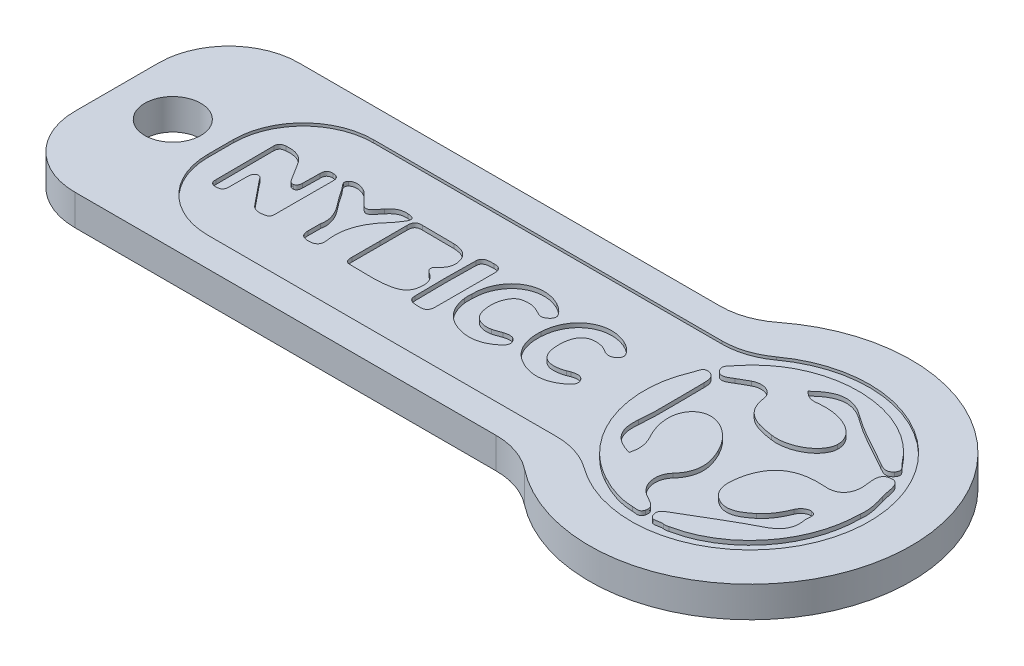
from build123d import *

# Parameters (mm, degrees)
ESQUISSE1_R             = 2
BOSS_EXTRU_1_DEPTH      = 2
ESQUISSE3_R             = 2
BOSS_EXTRU_2_DEPTH      = 0.2
ENL_V_MAT_EXTRU_1_DEPTH = 0.3
BOSS_EXTRU_3_DEPTH      = 0.3
CONG_1_R                = 5


with BuildPart() as part:
    # Esquisse1 → Boss.-Extru.1 (new body)
    with BuildSketch(Plane(origin=(0, 0, 0), x_dir=(1, 0, 0), z_dir=(0, 1, 0))):
        with BuildLine():
            Line((-18.5, 8), (18.5, 8))
            ThreePointArc((18.5, 8), (38.261355821, 0), (18.5, -8))
            Line((18.5, -8), (-18.5, -8))
            Line((-18.5, -8), (-18.5, 8))
        make_face()
        with Locations((-14.5, 0)):
            Circle(ESQUISSE1_R, mode=Mode.SUBTRACT)
    extrude(amount=BOSS_EXTRU_1_DEPTH)

    # Esquisse3 → Boss.-Extru.2 (add)
    with BuildSketch(Plane(origin=(0, 2, 0), x_dir=(1, 0, 0), z_dir=(0, 1, 0))):
        with BuildLine():
            Line((-18.5, -8), (18.5, -8))
            ThreePointArc((18.5, -8), (38.261355821, 0), (18.5, 8))
            Line((18.5, 8), (-18.5, 8))
            Line((-18.5, 8), (-18.5, -8))
        make_face()
        with Locations((-14.5, 0)):
            Circle(ESQUISSE3_R, mode=Mode.SUBTRACT)
        with BuildLine():
            Line((20.655136301, -5.913043478), (-11.087243835, -5.913043478))
            Line((-11.087243835, -5.913043478), (-11.087243835, 5.913043478))
            Line((-11.087243835, 5.913043478), (20.655136301, 5.913043478))
            ThreePointArc((20.655136301, 5.913043478), (35.261355821, 0), (20.655136301, -5.913043478))
        make_face(mode=Mode.SUBTRACT)
    extrude(amount=BOSS_EXTRU_2_DEPTH)

    # Esquisse4 → Enlèv. mat.-Extru.1 (cut)
    with BuildSketch(Plane(origin=(0, 2, 0), x_dir=(1, 0, 0), z_dir=(0, 1, 0))):
        with BuildLine():
            add(Edge.make_bspline(
                [(0.224987188, -1.924556037), (0.228633477, -1.260931428), (0.227504864, -0.597480451), (0.228286212, 0.066144158)],
                knots=[10, 10, 10, 10, 11, 11, 11, 11], degree=3))
            add(Edge.make_bspline(
                [(0.62837962, -2.452660236), (0.281265924, -2.464380451), (0.223381085, -2.208879767), (0.224987188, -1.924556037)],
                knots=[9, 9, 9, 9, 10, 10, 10, 10], degree=3))
            add(Edge.make_bspline(
                [(3.506690752, -2.346831037), (2.554206255, -2.570817365), (1.587874542, -2.420624982), (0.62837962, -2.452660236)],
                knots=[8, 8, 8, 8, 9, 9, 9, 9], degree=3))
            add(Edge.make_bspline(
                [(4.468290971, -1.524940119), (4.352282549, -2.028041193), (3.970333769, -2.237963263), (3.506690752, -2.346831037)],
                knots=[7, 7, 7, 7, 8, 8, 8, 8], degree=3))
            add(Edge.make_bspline(
                [(4.013221074, -0.175031819), (4.531905693, -0.497294319), (4.592156279, -0.987720197), (4.468290971, -1.524940119)],
                knots=[6, 6, 6, 6, 7, 7, 7, 7], degree=3))
            add(Edge.make_bspline(
                [(3.934131328, 0.525902141), (3.614907402, 0.248284978), (3.681842852, 0.030896697), (4.013221074, -0.175031819)],
                knots=[5, 5, 5, 5, 6, 6, 6, 6], degree=3))
            add(Edge.make_bspline(
                [(4.239442925, 1.857622404), (4.454530571, 1.347402385), (4.356862114, 0.893482805), (3.934131328, 0.525902141)],
                knots=[4, 4, 4, 4, 5, 5, 5, 5], degree=3))
            add(Edge.make_bspline(
                [(3.0322825, 2.547595793), (3.534493706, 2.526108732), (4.016064311, 2.387332707), (4.239442925, 1.857622404)],
                knots=[3, 3, 3, 3, 4, 4, 4, 4], degree=3))
            add(Edge.make_bspline(
                [(0.785321978, 2.564611809), (1.533831329, 2.542517033), (2.284445977, 2.579500822), (3.0322825, 2.547595793)],
                knots=[2, 2, 2, 2, 3, 3, 3, 3], degree=3))
            add(Edge.make_bspline(
                [(0.225898761, 1.992318059), (0.215025006, 2.398445207), (0.360594415, 2.577200187), (0.785321978, 2.564611809)],
                knots=[1, 1, 1, 1, 2, 2, 2, 2], degree=3))
            add(Edge.make_bspline(
                [(0.228286212, 0.066144158), (0.229089264, 0.708216594), (0.242979889, 1.350658), (0.225898761, 1.992318059)],
                knots=[0, 0, 0, 0, 1, 1, 1, 1], degree=3))
        make_face()
        with BuildLine():
            add(Edge.make_bspline(
                [(14.602153029, 1.507057756), (13.592825491, 1.74081093), (13.041367678, 1.232934953), (13.029387014, 0.077256658)],
                knots=[11, 11, 11, 11, 12, 12, 12, 12], degree=3))
            add(Edge.make_bspline(
                [(15.114890725, 1.26128051), (14.952891311, 1.359166008), (14.782731154, 1.465255656), (14.602153029, 1.507057756)],
                knots=[10, 10, 10, 10, 11, 11, 11, 11], degree=3))
            add(Edge.make_bspline(
                [(15.977932619, 1.407870012), (15.760023439, 1.153888616), (15.450522951, 1.05834716), (15.114890725, 1.26128051)],
                knots=[9, 9, 9, 9, 10, 10, 10, 10], degree=3))
            add(Edge.make_bspline(
                [(15.790235549, 2.126970305), (15.982794338, 1.921519279), (16.213986427, 1.683034612), (15.977932619, 1.407870012)],
                knots=[8, 8, 8, 8, 9, 9, 9, 9], degree=3))
            add(Edge.make_bspline(
                [(15.162379299, 2.559229191), (15.399301271, 2.45201093), (15.613390529, 2.315839397), (15.790235549, 2.126970305)],
                knots=[7, 7, 7, 7, 8, 8, 8, 8], degree=3))
            add(Edge.make_bspline(
                [(11.587974222, 0.202966814), (11.685642679, 2.205061662), (13.445584866, 3.336062394), (15.162379299, 2.559229191)],
                knots=[6, 6, 6, 6, 7, 7, 7, 7], degree=3))
            add(Edge.make_bspline(
                [(12.931110842, -2.370358283), (11.898863772, -1.838694611), (11.535276663, -0.87893924), (11.587974222, 0.202966814)],
                knots=[5, 5, 5, 5, 6, 6, 6, 6], degree=3))
            add(Edge.make_bspline(
                [(15.64646758, -2.177799494), (14.786290627, -2.80261717), (13.856313284, -2.846893537), (12.931110842, -2.370358283)],
                knots=[4, 4, 4, 4, 5, 5, 5, 5], degree=3))
            add(Edge.make_bspline(
                [(16.010315138, -1.39132967), (16.211642385, -1.755524494), (15.90327051, -1.991231037), (15.64646758, -2.177799494)],
                knots=[3, 3, 3, 3, 4, 4, 4, 4], degree=3))
            add(Edge.make_bspline(
                [(15.154305373, -1.192867365), (15.480214162, -1.086864533), (15.829563381, -1.064379084), (16.010315138, -1.39132967)],
                knots=[2, 2, 2, 2, 3, 3, 3, 3], degree=3))
            add(Edge.make_bspline(
                [(14.918772463, -1.291924885), (14.999251272, -1.2644909), (15.073566115, -1.21908592), (15.154305373, -1.192867365)],
                knots=[1, 1, 1, 1, 2, 2, 2, 2], degree=3))
            add(Edge.make_bspline(
                [(13.029387014, 0.077256658), (13.015670022, -1.229069807), (13.68320137, -1.713244904), (14.918772463, -1.291924885)],
                knots=[0, 0, 0, 0, 1, 1, 1, 1], degree=3))
        make_face()
        with BuildLine():
            add(Edge.make_bspline(
                [(-5.176035076, 0.000337322), (-5.176577678, -0.577686311), (-5.174038299, -1.155709943), (-5.179399212, -1.733733576)],
                knots=[0, 0, 0, 0, 1, 1, 1, 1], degree=3))
            add(Edge.make_bspline(
                [(-5.172236858, 2.119721135), (-5.177489251, 1.413252629), (-5.175383953, 0.706784123), (-5.176035076, 0.000337322)],
                knots=[18, 18, 18, 18, 19, 19, 19, 19], degree=3))
            add(Edge.make_bspline(
                [(-5.639895134, 2.586749992), (-5.319586004, 2.583450969), (-5.169827703, 2.441245695), (-5.172236858, 2.119721135)],
                knots=[17, 17, 17, 17, 18, 18, 18, 18], degree=3))
            add(Edge.make_bspline(
                [(-6.093923235, 2.115033049), (-6.09887177, 2.434517424), (-5.970882683, 2.59017924), (-5.639895134, 2.586749992)],
                knots=[16, 16, 16, 16, 17, 17, 17, 17], degree=3))
            add(Edge.make_bspline(
                [(-6.114021233, 0.896043889), (-6.088345281, 1.301259465), (-6.08765075, 1.70868886), (-6.093923235, 2.115033049)],
                knots=[15, 15, 15, 15, 16, 16, 16, 16], degree=3))
            add(Edge.make_bspline(
                [(-6.356651384, 0.487399065), (-6.14538366, 0.528202776), (-6.124157048, 0.736735784), (-6.114021233, 0.896043889)],
                knots=[14, 14, 14, 14, 15, 15, 15, 15], degree=3))
            add(Edge.make_bspline(
                [(-6.756289006, 0.751624797), (-6.662983074, 0.606077092), (-6.556068669, 0.448809172), (-6.356651384, 0.487399065)],
                knots=[13, 13, 13, 13, 14, 14, 14, 14], degree=3))
            add(Edge.make_bspline(
                [(-7.472394133, 1.887704289), (-7.244153801, 1.502760344), (-6.998007585, 1.128451409), (-6.756289006, 0.751624797)],
                knots=[12, 12, 12, 12, 13, 13, 13, 13], degree=3))
            add(Edge.make_bspline(
                [(-8.999299382, 2.591438078), (-8.346765568, 2.653424992), (-7.822307658, 2.477925627), (-7.472394133, 1.887704289)],
                knots=[11, 11, 11, 11, 12, 12, 12, 12], degree=3))
            add(Edge.make_bspline(
                [(-9.450826151, 2.172535671), (-9.436859715, 2.458341505), (-9.289908617, 2.578171994), (-8.999299382, 2.591438078)],
                knots=[10, 10, 10, 10, 11, 11, 11, 11], degree=3))
            add(Edge.make_bspline(
                [(-9.429062297, -2.001388557), (-9.437185031, -0.610092066), (-9.444070539, 0.781188921), (-9.450826151, 2.172535671)],
                knots=[9, 9, 9, 9, 10, 10, 10, 10], degree=3))
            add(Edge.make_bspline(
                [(-9.002103481, -2.437008874), (-9.296330826, -2.430134949), (-9.435696319, -2.290063772), (-9.429062297, -2.001388557)],
                knots=[8, 8, 8, 8, 9, 9, 9, 9], degree=3))
            add(Edge.make_bspline(
                [(-8.50689843, -2.001388557), (-8.512042114, -2.334299424), (-8.69381371, -2.444124348), (-9.002103481, -2.437008874)],
                knots=[7, 7, 7, 7, 8, 8, 8, 8], degree=3))
            add(Edge.make_bspline(
                [(-8.503599406, -0.717026643), (-8.504337346, -1.145205158), (-8.510132341, -1.573296857), (-8.50689843, -2.001388557)],
                knots=[6, 6, 6, 6, 7, 7, 7, 7], degree=3))
            add(Edge.make_bspline(
                [(-8.285820451, -0.219047737), (-8.482068937, -0.304214631), (-8.503230436, -0.51778299), (-8.503599406, -0.717026643)],
                knots=[5, 5, 5, 5, 6, 6, 6, 6], degree=3))
            add(Edge.make_bspline(
                [(-7.83687111, -0.48566092), (-7.953031462, -0.343802912), (-8.052892033, -0.118080256), (-8.285820451, -0.219047737)],
                knots=[4, 4, 4, 4, 5, 5, 5, 5], degree=3))
            add(Edge.make_bspline(
                [(-6.463544084, -2.180664435), (-6.917159807, -1.612277424), (-7.37596281, -1.0480576), (-7.83687111, -0.48566092)],
                knots=[3, 3, 3, 3, 4, 4, 4, 4], degree=3))
            add(Edge.make_bspline(
                [(-5.46884511, -2.427223029), (-5.824206365, -2.510827228), (-6.192264519, -2.520550666), (-6.463544084, -2.180664435)],
                knots=[2, 2, 2, 2, 3, 3, 3, 3], degree=3))
            add(Edge.make_bspline(
                [(-5.179399212, -1.733733576), (-5.181960296, -2.003038068), (-5.100765252, -2.340580256), (-5.46884511, -2.427223029)],
                knots=[1, 1, 1, 1, 2, 2, 2, 2], degree=3))
        make_face()
        with BuildLine():
            add(Edge.make_bspline(
                [(11.153110843, -1.367455158), (11.365724222, -1.72565965), (11.071329788, -1.969006037), (10.814266409, -2.164256135)],
                knots=[10, 10, 10, 10, 11, 11, 11, 11], degree=3))
            add(Edge.make_bspline(
                [(10.283123636, -1.193909162), (10.603736624, -1.096761604), (10.959423441, -1.04128592), (11.153110843, -1.367455158)],
                knots=[9, 9, 9, 9, 10, 10, 10, 10], degree=3))
            add(Edge.make_bspline(
                [(9.677839652, -1.395757307), (9.884636331, -1.353911799), (10.079539163, -1.255635627), (10.283123636, -1.193909162)],
                knots=[8, 8, 8, 8, 9, 9, 9, 9], degree=3))
            add(Edge.make_bspline(
                [(8.273063383, -0.709039533), (8.464406742, -1.266574494), (8.99520225, -1.533795393), (9.677839652, -1.395757307)],
                knots=[7, 7, 7, 7, 8, 8, 8, 8], degree=3))
            add(Edge.make_bspline(
                [(8.785714261, 1.445461516), (8.229481547, 1.172944817), (7.985679374, 0.128825603), (8.273063383, -0.709039533)],
                knots=[6, 6, 6, 6, 7, 7, 7, 7], degree=3))
            add(Edge.make_bspline(
                [(9.155031253, 1.532798821), (9.030189261, 1.511181535), (8.896578812, 1.499808586), (8.785714261, 1.445461516)],
                knots=[5, 5, 5, 5, 6, 6, 6, 6], degree=3))
            add(Edge.make_bspline(
                [(10.371415921, 1.236494426), (9.994372269, 1.459438957), (9.60274346, 1.610412688), (9.155031253, 1.532798821)],
                knots=[4, 4, 4, 4, 5, 5, 5, 5], degree=3))
            add(Edge.make_bspline(
                [(11.115866605, 1.405091887), (10.92079014, 1.195256633), (10.666070804, 1.062210491), (10.371415921, 1.236494426)],
                knots=[3, 3, 3, 3, 4, 4, 4, 4], degree=3))
            add(Edge.make_bspline(
                [(10.994670901, 2.079655363), (11.171602737, 1.898773381), (11.349142288, 1.656078117), (11.115866605, 1.405091887)],
                knots=[2, 2, 2, 2, 3, 3, 3, 3], degree=3))
            add(Edge.make_bspline(
                [(10.381312991, 2.533401311), (10.606167484, 2.420539982), (10.818694046, 2.259582365), (10.994670901, 2.079655363)],
                knots=[1, 1, 1, 1, 2, 2, 2, 2], degree=3))
            add(Edge.make_bspline(
                [(6.78550767, 0.075867595), (6.771248075, 2.16234799), (8.614078226, 3.420882023), (10.381312991, 2.533401311)],
                knots=[0, 0, 0, 0, 1, 1, 1, 1], degree=3))
            add(Edge.make_bspline(
                [(6.788329203, -0.437217365), (6.764150834, -0.269488069), (6.785290629, -0.095334358), (6.78550767, 0.075867595)],
                knots=[13, 13, 13, 13, 14, 14, 14, 14], degree=3))
            add(Edge.make_bspline(
                [(8.265510355, -2.456393342), (7.376488651, -2.093934846), (6.922395439, -1.369799201), (6.788329203, -0.437217365)],
                knots=[12, 12, 12, 12, 13, 13, 13, 13], degree=3))
            add(Edge.make_bspline(
                [(10.814266409, -2.164256135), (10.026320706, -2.763028888), (9.152687211, -2.818244123), (8.265510355, -2.456393342)],
                knots=[11, 11, 11, 11, 12, 12, 12, 12], degree=3))
        make_face()
        with BuildLine():
            add(Edge.make_bspline(
                [(-2.994620941, 2.154404289), (-2.27463078, 1.389421526), (-2.259850287, 1.372145061), (-1.589367181, 2.219733635)],
                knots=[5, 5, 5, 5, 6, 6, 6, 6], degree=3))
            add(Edge.make_bspline(
                [(-3.56897658, 2.659198283), (-3.348159051, 2.549028264), (-3.169534295, 2.340278215), (-2.994620941, 2.154404289)],
                knots=[4, 4, 4, 4, 5, 5, 5, 5], degree=3))
            add(Edge.make_bspline(
                [(-4.596861126, 2.643701555), (-4.345202068, 2.899028605), (-3.899009149, 2.823845598), (-3.56897658, 2.659198283)],
                knots=[3, 3, 3, 3, 4, 4, 4, 4], degree=3))
            add(Edge.make_bspline(
                [(-4.318028533, 1.886402043), (-4.469436346, 2.121457463), (-4.860023357, 2.376827922), (-4.596861126, 2.643701555)],
                knots=[2, 2, 2, 2, 3, 3, 3, 3], degree=3))
            add(Edge.make_bspline(
                [(-3.613448284, 0.892006926), (-3.869122601, 1.206759807), (-4.098122576, 1.545083342), (-4.318028533, 1.886402043)],
                knots=[1, 1, 1, 1, 2, 2, 2, 2], degree=3))
            add(Edge.make_bspline(
                [(-2.970746429, -0.986504768), (-2.823245355, -0.33008592), (-3.134872845, 0.302523528), (-3.613448284, 0.892006926)],
                knots=[0, 0, 0, 0, 1, 1, 1, 1], degree=3))
            add(Edge.make_bspline(
                [(-2.971549481, -1.886704084), (-2.973047064, -1.629553889), (-2.971223919, -1.372403693), (-2.970746429, -0.986504768)],
                knots=[12, 12, 12, 12, 13, 13, 13, 13], degree=3))
            add(Edge.make_bspline(
                [(-2.382717206, -2.479226056), (-2.788779242, -2.464727717), (-2.969248846, -2.276075666), (-2.971549481, -1.886704084)],
                knots=[11, 11, 11, 11, 12, 12, 12, 12], degree=3))
            add(Edge.make_bspline(
                [(-1.708349066, -1.796415021), (-1.634251263, -2.28927176), (-1.886018841, -2.497110236), (-2.382717206, -2.479226056)],
                knots=[10, 10, 10, 10, 11, 11, 11, 11], degree=3))
            add(Edge.make_bspline(
                [(-0.54991435, 1.58862177), (-1.432381415, 0.627911418), (-1.908916669, -0.461873225), (-1.708349066, -1.796415021)],
                knots=[9, 9, 9, 9, 10, 10, 10, 10], degree=3))
            add(Edge.make_bspline(
                [(-0.136386103, 2.15896215), (-0.2649612, 1.962540031), (-0.392038715, 1.760474846), (-0.54991435, 1.58862177)],
                knots=[8, 8, 8, 8, 9, 9, 9, 9], degree=3))
            add(Edge.make_bspline(
                [(-0.444757978, 2.762336174), (0.058516729, 2.730474553), (0.108284234, 2.532663371), (-0.136386103, 2.15896215)],
                knots=[7, 7, 7, 7, 8, 8, 8, 8], degree=3))
            add(Edge.make_bspline(
                [(-1.589367181, 2.219733635), (-1.281017011, 2.609539299), (-0.947468378, 2.794154387), (-0.444757978, 2.762336174)],
                knots=[6, 6, 6, 6, 7, 7, 7, 7], degree=3))
        make_face()
        with BuildLine():
            add(Edge.make_bspline(
                [(6.295667802, 2.165603606), (6.288896122, 1.461392326), (6.292281962, 0.757094231), (6.291652543, 0.052861248)],
                knots=[6, 6, 6, 6, 7, 7, 7, 7], degree=3))
            add(Edge.make_bspline(
                [(5.71134998, 2.74358383), (6.112572001, 2.753958391), (6.29946602, 2.567172893), (6.295667802, 2.165603606)],
                knots=[5, 5, 5, 5, 6, 6, 6, 6], degree=3))
            add(Edge.make_bspline(
                [(4.877825664, 2.268437639), (4.890761308, 2.75808217), (5.342445366, 2.733990617), (5.71134998, 2.74358383)],
                knots=[4, 4, 4, 4, 5, 5, 5, 5], degree=3))
            add(Edge.make_bspline(
                [(4.874591753, -2.082561896), (4.840841875, -0.632814729), (4.839561333, 0.818820696), (4.877825664, 2.268437639)],
                knots=[3, 3, 3, 3, 4, 4, 4, 4], degree=3))
            add(Edge.make_bspline(
                [(5.736548442, -2.599119513), (5.332526591, -2.593823713), (4.886789458, -2.605978009), (4.874591753, -2.082561896)],
                knots=[2, 2, 2, 2, 3, 3, 3, 3], degree=3))
            add(Edge.make_bspline(
                [(6.289894511, -1.995919123), (6.29052393, -2.36896922), (6.171889311, -2.60476258), (5.736548442, -2.599119513)],
                knots=[1, 1, 1, 1, 2, 2, 2, 2], degree=3))
            add(Edge.make_bspline(
                [(6.291652543, 0.052861248), (6.291109941, -0.630036604), (6.28883101, -1.313021272), (6.289894511, -1.995919123)],
                knots=[0, 0, 0, 0, 1, 1, 1, 1], degree=3))
        make_face()
    extrude(amount=-ENL_V_MAT_EXTRU_1_DEPTH, mode=Mode.SUBTRACT)

    # Esquisse5 → Boss.-Extru.3 (add)
    with BuildSketch(Plane(origin=(0, 2, 0), x_dir=(1, 0, 0), z_dir=(0, 1, 0))):
        with BuildLine():
            add(Edge.make_bspline(
                [(23.186663146, -6.769797032), (19.809617805, -4.933230685), (18.300149632, -0.679304914), (19.787679299, 2.792463637)],
                knots=[9, 9, 9, 9, 10, 10, 10, 10], degree=3))
            add(Edge.make_bspline(
                [(19.787679299, 2.792463637), (19.903969875, 3.063808315), (19.90182551, 3.526413876), (20.358905207, 3.437257768)],
                knots=[10, 10, 10, 10, 11, 11, 11, 11], degree=3))
            add(Edge.make_bspline(
                [(20.358905207, 3.437257768), (20.775736818, 3.356019316), (20.87586218, 3.003106284), (20.870748693, 2.587676757)],
                knots=[11, 11, 11, 11, 12, 12, 12, 12], degree=3))
            add(Edge.make_bspline(
                [(20.870748693, 2.587676757), (20.851779309, 1.040022388), (20.974997834, -0.519467229), (20.824727316, -2.052853322)],
                knots=[12, 12, 12, 12, 13, 13, 13, 13], degree=3))
            add(Edge.make_bspline(
                [(20.824727316, -2.052853322), (20.689962209, -3.427226486), (21.291704084, -4.053216183), (22.495847638, -4.410995275)],
                knots=[13, 13, 13, 13, 14, 14, 14, 14], degree=3))
            add(Edge.make_bspline(
                [(22.495847638, -4.410995275), (22.689500314, -3.765376388), (22.587395539, -3.237532638), (22.270524338, -2.661688097)],
                knots=[0, 0, 0, 0, 1, 1, 1, 1], degree=3))
            add(Edge.make_bspline(
                [(22.270524338, -2.661688097), (21.485191808, -1.2333759), (21.653277053, 0.156172771), (22.576508761, 0.620386606)],
                knots=[1, 1, 1, 1, 2, 2, 2, 2], degree=3))
            add(Edge.make_bspline(
                [(22.576508761, 0.620386606), (23.507658126, 1.088518032), (24.876752853, 0.314154756), (25.561795069, -1.087229162)],
                knots=[2, 2, 2, 2, 3, 3, 3, 3], degree=3))
            add(Edge.make_bspline(
                [(25.561795069, -1.087229162), (26.074133409, -2.134999006), (26.251950772, -3.132623693), (25.35082252, -4.130743234)],
                knots=[3, 3, 3, 3, 4, 4, 4, 4], degree=3))
            add(Edge.make_bspline(
                [(25.35082252, -4.130743234), (24.736379405, -4.811166818), (24.985950528, -5.909246768), (25.740107286, -6.388759825)],
                knots=[4, 4, 4, 4, 5, 5, 5, 5], degree=3))
            add(Edge.make_bspline(
                [(25.740107286, -6.388759825), (25.911656505, -6.49779255), (26.091783184, -6.593464229), (26.267951036, -6.695239102)],
                knots=[5, 5, 5, 5, 6, 6, 6, 6], degree=3))
            add(Edge.make_bspline(
                [(26.267951036, -6.695239102), (26.529893497, -6.846664278), (26.743505264, -7.040811807), (26.661194629, -7.375167833)],
                knots=[6, 6, 6, 6, 7, 7, 7, 7], degree=3))
            add(Edge.make_bspline(
                [(26.661194629, -7.375167833), (26.55991461, -7.786391104), (26.214012003, -7.63529583), (25.956688175, -7.628862735)],
                knots=[7, 7, 7, 7, 8, 8, 8, 8], degree=3))
            add(Edge.make_bspline(
                [(25.956688175, -7.628862735), (24.954939708, -7.603295303), (24.048368068, -7.23825836), (23.186663146, -6.769797032)],
                knots=[8, 8, 8, 8, 9, 9, 9, 9], degree=3))
        make_face()
        with BuildLine():
            add(Edge.make_bspline(
                [(29.456952041, 3.520475634), (29.409446103, 2.504623842), (27.919937022, 1.549803984), (26.503501309, 1.757642461)],
                knots=[3, 3, 3, 3, 4, 4, 4, 4], degree=3))
            add(Edge.make_bspline(
                [(26.503501309, 1.757642461), (25.335811964, 1.929109204), (24.195669464, 2.169525537), (23.97545965, 3.74307724)],
                knots=[4, 4, 4, 4, 5, 5, 5, 5], degree=3))
            add(Edge.make_bspline(
                [(23.97545965, 3.74307724), (23.890674747, 4.347953188), (23.203983019, 4.748619584), (22.453125285, 4.37294329)],
                knots=[5, 5, 5, 5, 6, 6, 6, 6], degree=3))
            add(Edge.make_bspline(
                [(22.453125285, 4.37294329), (22.198935529, 4.245848412), (21.95414799, 4.098959394), (21.711174914, 3.950998192)],
                knots=[6, 6, 6, 6, 7, 7, 7, 7], degree=3))
            add(Edge.make_bspline(
                [(21.711174914, 3.950998192), (21.36015882, 3.737303949), (20.97582259, 3.449629106), (20.651198684, 3.911574862)],
                knots=[7, 7, 7, 7, 8, 8, 8, 8], degree=3))
            add(Edge.make_bspline(
                [(20.651198684, 3.911574862), (20.37061674, 4.311086601), (20.809056955, 4.578389975), (21.005183898, 4.828868329)],
                knots=[8, 8, 8, 8, 9, 9, 9, 9], degree=3))
            add(Edge.make_bspline(
                [(21.005183898, 4.828868329), (23.928283614, 8.56352781), (30.092343955, 8.488392552), (32.918122479, 4.687917553)],
                knots=[9, 9, 9, 9, 10, 10, 10, 10], degree=3))
            add(Edge.make_bspline(
                [(32.918122479, 4.687917553), (33.085218016, 4.463171581), (33.509967284, 4.24906496), (33.194745595, 3.874873227)],
                knots=[10, 10, 10, 10, 11, 11, 11, 11], degree=3))
            add(Edge.make_bspline(
                [(33.194745595, 3.874873227), (32.899647948, 3.524434462), (32.5761787, 3.664642958), (32.22565746, 3.874130946)],
                knots=[11, 11, 11, 11, 12, 12, 12, 12], degree=3))
            add(Edge.make_bspline(
                [(32.22565746, 3.874130946), (30.969719238, 4.624658778), (29.615800019, 5.237122479), (28.44893543, 6.103610985)],
                knots=[12, 12, 12, 12, 13, 13, 13, 13], degree=3))
            add(Edge.make_bspline(
                [(28.44893543, 6.103610985), (27.188048672, 7.040038787), (26.193393106, 6.833107542), (25.100591593, 5.772636459)],
                knots=[13, 13, 13, 13, 14, 14, 14, 14], degree=3))
            add(Edge.make_bspline(
                [(25.100591593, 5.772636459), (25.3971738, 5.479930604), (25.666374112, 5.331886927), (26.013596329, 5.360258529)],
                knots=[0, 0, 0, 0, 1, 1, 1, 1], degree=3))
            add(Edge.make_bspline(
                [(26.013596329, 5.360258529), (26.256899307, 5.380217621), (26.50086209, 5.404218016), (26.744494971, 5.402403553)],
                knots=[1, 1, 1, 1, 2, 2, 2, 2], degree=3))
            add(Edge.make_bspline(
                [(26.744494971, 5.402403553), (28.303283545, 5.391021923), (29.505447685, 4.55381225), (29.456952041, 3.520475634)],
                knots=[2, 2, 2, 2, 3, 3, 3, 3], degree=3))
        make_face()
        with BuildLine():
            add(Edge.make_bspline(
                [(28.008680752, -2.001388557), (28.386418936, -0.107419202), (29.587098515, 0.635397163), (31.650307773, 0.477786318)],
                knots=[11, 11, 11, 11, 12, 12, 12, 12], degree=3))
            add(Edge.make_bspline(
                [(31.650307773, 0.477786318), (32.417990526, 0.419063701), (33.010660087, 0.836142739), (32.989876239, 1.811746445)],
                knots=[12, 12, 12, 12, 13, 13, 13, 13], degree=3))
            add(Edge.make_bspline(
                [(32.989876239, 1.811746445), (32.978164706, 2.360538994), (32.650406728, 3.276925229), (33.476812098, 3.344967587)],
                knots=[13, 13, 13, 13, 14, 14, 14, 14], degree=3))
            add(Edge.make_bspline(
                [(33.476812098, 3.344967587), (34.182473212, 3.403277826), (34.110719452, 2.450684809), (34.290846131, 1.919624511)],
                knots=[14, 14, 14, 14, 15, 15, 15, 15], degree=3))
            add(Edge.make_bspline(
                [(34.290846131, 1.919624511), (34.511550799, 1.269222041), (34.657202684, 0.583272593), (34.572252831, 0.043016267)],
                knots=[15, 15, 15, 15, 16, 16, 16, 16], degree=3))
            add(Edge.make_bspline(
                [(34.572252831, 0.043016267), (34.557242274, -3.684715265), (31.980540019, -6.861509883), (28.528111992, -7.568985459)],
                knots=[0, 0, 0, 0, 1, 1, 1, 1], degree=3))
            add(Edge.make_bspline(
                [(28.528111992, -7.568985459), (28.409347149, -7.593233282), (28.279365625, -7.630677198), (28.166703975, -7.606264424)],
                knots=[1, 1, 1, 1, 2, 2, 2, 2], degree=3))
            add(Edge.make_bspline(
                [(28.166703975, -7.606264424), (27.847688408, -7.537479786), (27.395062393, -7.903011582), (27.221038907, -7.385394805)],
                knots=[2, 2, 2, 2, 3, 3, 3, 3], degree=3))
            add(Edge.make_bspline(
                [(27.221038907, -7.385394805), (27.065984805, -6.923366573), (27.456754131, -6.765673253), (27.778408916, -6.581257842)],
                knots=[3, 3, 3, 3, 4, 4, 4, 4], degree=3))
            add(Edge.make_bspline(
                [(27.778408916, -6.581257842), (29.151792373, -5.793780948), (30.49004123, -4.937849317), (31.901363456, -4.226579865)],
                knots=[4, 4, 4, 4, 5, 5, 5, 5], degree=3))
            add(Edge.make_bspline(
                [(31.901363456, -4.226579865), (32.758779647, -3.794737697), (33.131239393, -3.238522345), (32.960349979, -2.315290637)],
                knots=[5, 5, 5, 5, 6, 6, 6, 6], degree=3))
            add(Edge.make_bspline(
                [(32.960349979, -2.315290637), (32.90839036, -2.033883937), (33.154827411, -1.581257922), (32.667231747, -1.528308596)],
                knots=[6, 6, 6, 6, 7, 7, 7, 7], degree=3))
            add(Edge.make_bspline(
                [(32.667231747, -1.528308596), (32.350195595, -1.493998752), (32.043386415, -1.733177951), (31.914889452, -2.047739836)],
                knots=[7, 7, 7, 7, 8, 8, 8, 8], degree=3))
            add(Edge.make_bspline(
                [(31.914889452, -2.047739836), (31.664328622, -2.660368488), (31.338550058, -3.217903449), (30.828521035, -3.640178449)],
                knots=[8, 8, 8, 8, 9, 9, 9, 9], degree=3))
            add(Edge.make_bspline(
                [(30.828521035, -3.640178449), (30.215067627, -4.148228058), (29.523757265, -4.58204964), (28.723249229, -4.145918742)],
                knots=[9, 9, 9, 9, 10, 10, 10, 10], degree=3))
            add(Edge.make_bspline(
                [(28.723249229, -4.145918742), (27.87045167, -3.681416242), (27.841750166, -2.838515754), (28.008680752, -2.001388557)],
                knots=[10, 10, 10, 10, 11, 11, 11, 11], degree=3))
        make_face()
    extrude(amount=BOSS_EXTRU_3_DEPTH)

    # Congé1
    cong_1_edges = [part.edges().sort_by_distance(p)[0] for p in [
        (-18.5, 1, -8),
        (-18.5, 1, 8),
        (-11.087243835, 2.1, 5.913043478),
        (-11.087243835, 2.1, -5.913043478),
        (18.5, 1, -8),
        (18.5, 1, 8),
        (20.655136301, 2.1, 5.913043478),
        (20.655136301, 2.1, -5.913043478),
    ]]
    fillet(cong_1_edges, radius=CONG_1_R)


solid = part.part
